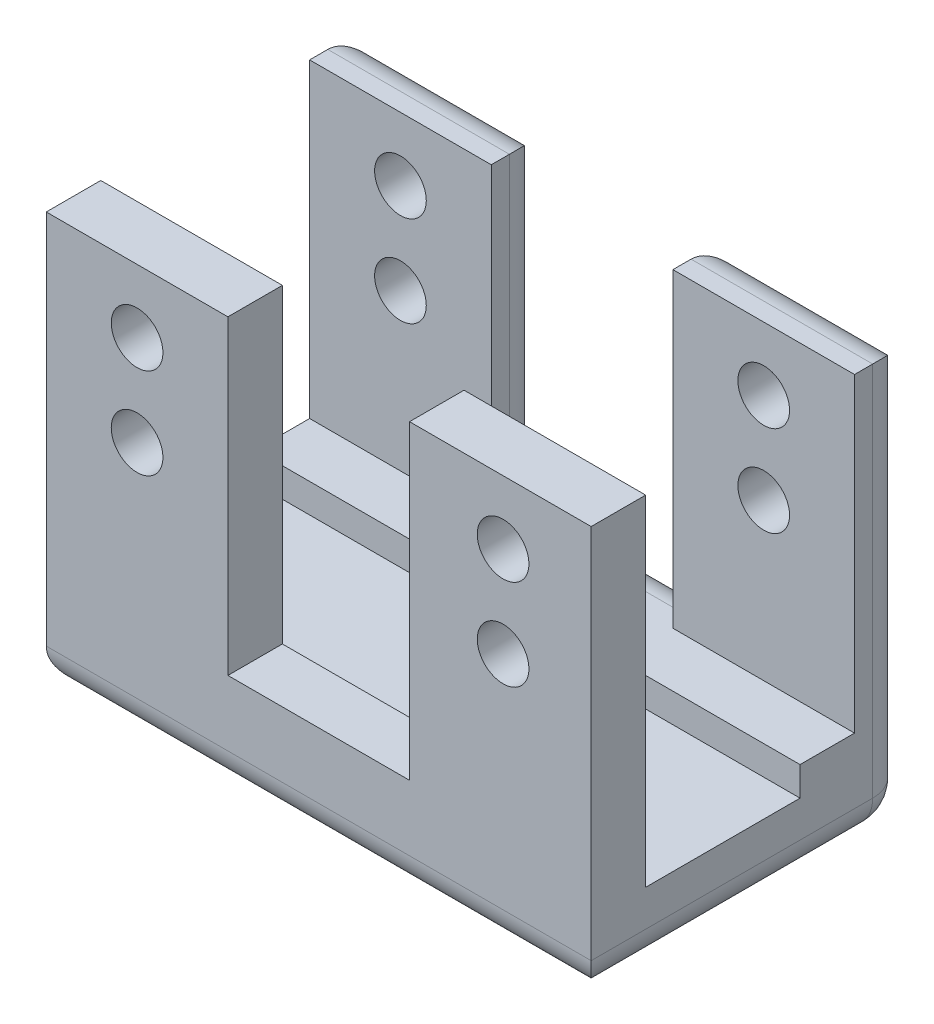
from build123d import *

# Parameters (mm, degrees)
SKETCH1_W           = 30
SKETCH1_H           = 17.5
BOSS_EXTRUDE1_DEPTH = 4
SKETCH2_W           = 30
SKETCH2_H           = 6
BOSS_EXTRUDE2_DEPTH = 1.601
SKETCH3_W           = 10
SKETCH3_H           = 3
BOSS_EXTRUDE3_DEPTH = 18.7
SKETCH4_W           = 10
SKETCH4_H           = 3
BOSS_EXTRUDE4_DEPTH = 17.099
SKETCH5_W           = 10
SKETCH5_H           = 3
BOSS_EXTRUDE5_DEPTH = 1.601
FILLET1_R           = 2
CUT_EXTRUDE1_REACH  = 42.318
SKETCH6_R           = 1.4224
CUT_EXTRUDE2_REACH  = 42.318
SKETCH7_R           = 1.4224


with BuildPart() as part:
    # Sketch1 → Boss-Extrude1 (new body)
    with BuildSketch(Plane(origin=(0, 0, 0), x_dir=(1, 0, 0), z_dir=(0, 1, 0))):
        with Locations((15, 8.75)):
            Rectangle(SKETCH1_W, SKETCH1_H)
    extrude(amount=BOSS_EXTRUDE1_DEPTH)

    # Sketch2 → Boss-Extrude2 (add)
    with BuildSketch(Plane(origin=(0, 4, 0), x_dir=(1, 0, 0), z_dir=(0, 1, 0))):
        with Locations((15, 14.5)):
            Rectangle(SKETCH2_W, SKETCH2_H)
    extrude(amount=BOSS_EXTRUDE2_DEPTH)

    # Sketch3 → Boss-Extrude3 (add)
    with BuildSketch(Plane(origin=(0, 4, 0), x_dir=(1, 0, 0), z_dir=(0, 1, 0))):
        with Locations((5, 1.5)):
            Rectangle(SKETCH3_W, SKETCH3_H)
        with Locations((25, 1.5)):
            Rectangle(SKETCH3_W, SKETCH3_H)
    extrude(amount=BOSS_EXTRUDE3_DEPTH)

    # Sketch4 → Boss-Extrude4 (add)
    with BuildSketch(Plane(origin=(0, 5.601, 0), x_dir=(1, 0, 0), z_dir=(0, 1, 0))):
        with Locations((5, 16)):
            Rectangle(SKETCH4_W, SKETCH4_H)
        with Locations((25, 16)):
            Rectangle(SKETCH4_W, SKETCH4_H)
    extrude(amount=BOSS_EXTRUDE4_DEPTH)

    # Sketch5 → Boss-Extrude5 (add)
    with BuildSketch(Plane(origin=(0, 4, 0), x_dir=(1, 0, 0), z_dir=(0, 1, 0))):
        with Locations((15, 1.5)):
            Rectangle(SKETCH5_W, SKETCH5_H)
    extrude(amount=BOSS_EXTRUDE5_DEPTH)

    # Fillet1
    fillet1_edges = [part.edges().sort_by_distance(p)[0] for p in [
        (30, 11.35, -17.5),
        (25, 22.7, -17.5),
        (20, 14.1505, -17.5),
        (15, 5.601, -17.5),
        (10, 14.1505, -17.5),
        (5, 22.7, -17.5),
        (0, 11.35, -17.5),
        (15, 0, 0),
        (30, 0, -8.75),
        (15, 0, -17.5),
        (0, 0, -8.75),
    ]]
    fillet(fillet1_edges, radius=FILLET1_R)

    # Sketch6 → Cut-Extrude1 (cut, up to next)
    with BuildSketch(Plane.XY.offset(-14.5), mode=Mode.PRIVATE) as cut_extrude1_sk1:
        with Locations((5, 19.2)):
            Circle(SKETCH6_R)
    cut_extrude1_tool1 = extrude(cut_extrude1_sk1.sketch, amount=-CUT_EXTRUDE1_REACH, mode=Mode.PRIVATE) & part.part
    # Sketch6 → Cut-Extrude1 (cut, up to next)
    with BuildSketch(Plane.XY.offset(-14.5), mode=Mode.PRIVATE) as cut_extrude1_sk2:
        with Locations((25, 19.2)):
            Circle(SKETCH6_R)
    cut_extrude1_tool2 = extrude(cut_extrude1_sk2.sketch, amount=-CUT_EXTRUDE1_REACH, mode=Mode.PRIVATE) & part.part
    # Sketch6 → Cut-Extrude1 (cut, up to next)
    with BuildSketch(Plane.XY.offset(-14.5), mode=Mode.PRIVATE) as cut_extrude1_sk3:
        with Locations((5, 14.2)):
            Circle(SKETCH6_R)
    cut_extrude1_tool3 = extrude(cut_extrude1_sk3.sketch, amount=-CUT_EXTRUDE1_REACH, mode=Mode.PRIVATE) & part.part
    # Sketch6 → Cut-Extrude1 (cut, up to next)
    with BuildSketch(Plane.XY.offset(-14.5), mode=Mode.PRIVATE) as cut_extrude1_sk4:
        with Locations((25, 14.2)):
            Circle(SKETCH6_R)
    cut_extrude1_tool4 = extrude(cut_extrude1_sk4.sketch, amount=-CUT_EXTRUDE1_REACH, mode=Mode.PRIVATE) & part.part
    add(cut_extrude1_tool1.solids().sort_by_distance((5, 19.2, -14.5))[0], mode=Mode.SUBTRACT)
    add(cut_extrude1_tool2.solids().sort_by_distance((25, 19.2, -14.5))[0], mode=Mode.SUBTRACT)
    add(cut_extrude1_tool3.solids().sort_by_distance((5, 14.2, -14.5))[0], mode=Mode.SUBTRACT)
    add(cut_extrude1_tool4.solids().sort_by_distance((25, 14.2, -14.5))[0], mode=Mode.SUBTRACT)

    # Sketch7 → Cut-Extrude2 (cut, up to next)
    with BuildSketch(Plane(origin=(0, 0, -3), x_dir=(-1, 0, 0), z_dir=(0, 0, -1)), mode=Mode.PRIVATE) as cut_extrude2_sk1:
        with Locations((-5, 19.2)):
            Circle(SKETCH7_R)
    cut_extrude2_tool1 = extrude(cut_extrude2_sk1.sketch, amount=-CUT_EXTRUDE2_REACH, mode=Mode.PRIVATE) & part.part
    # Sketch7 → Cut-Extrude2 (cut, up to next)
    with BuildSketch(Plane(origin=(0, 0, -3), x_dir=(-1, 0, 0), z_dir=(0, 0, -1)), mode=Mode.PRIVATE) as cut_extrude2_sk2:
        with Locations((-25.150725931, 19.2)):
            Circle(SKETCH7_R)
    cut_extrude2_tool2 = extrude(cut_extrude2_sk2.sketch, amount=-CUT_EXTRUDE2_REACH, mode=Mode.PRIVATE) & part.part
    # Sketch7 → Cut-Extrude2 (cut, up to next)
    with BuildSketch(Plane(origin=(0, 0, -3), x_dir=(-1, 0, 0), z_dir=(0, 0, -1)), mode=Mode.PRIVATE) as cut_extrude2_sk3:
        with Locations((-25.150725931, 14.2)):
            Circle(SKETCH7_R)
    cut_extrude2_tool3 = extrude(cut_extrude2_sk3.sketch, amount=-CUT_EXTRUDE2_REACH, mode=Mode.PRIVATE) & part.part
    # Sketch7 → Cut-Extrude2 (cut, up to next)
    with BuildSketch(Plane(origin=(0, 0, -3), x_dir=(-1, 0, 0), z_dir=(0, 0, -1)), mode=Mode.PRIVATE) as cut_extrude2_sk4:
        with Locations((-5, 14.2)):
            Circle(SKETCH7_R)
    cut_extrude2_tool4 = extrude(cut_extrude2_sk4.sketch, amount=-CUT_EXTRUDE2_REACH, mode=Mode.PRIVATE) & part.part
    add(cut_extrude2_tool1.solids().sort_by_distance((5, 19.2, -3))[0], mode=Mode.SUBTRACT)
    add(cut_extrude2_tool2.solids().sort_by_distance((25.150726, 19.2, -3))[0], mode=Mode.SUBTRACT)
    add(cut_extrude2_tool3.solids().sort_by_distance((25.150726, 14.2, -3))[0], mode=Mode.SUBTRACT)
    add(cut_extrude2_tool4.solids().sort_by_distance((5, 14.2, -3))[0], mode=Mode.SUBTRACT)


solid = part.part
